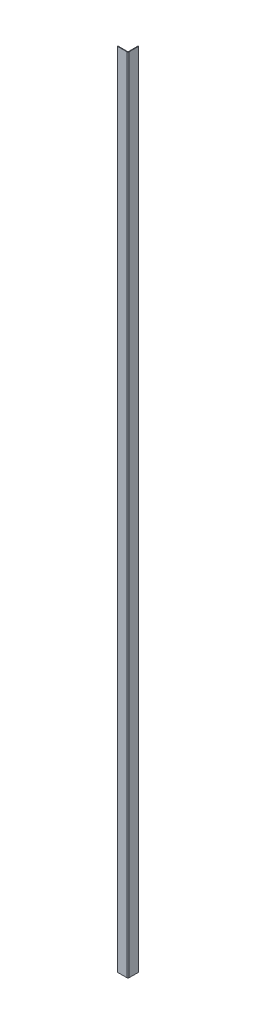
from build123d import *

# Parameters (mm, degrees)
SKETCH1_W                    = 40
SKETCH1_H                    = 3047
BASE_FLANGE1_DEPTH           = 2
EDGE_FLANGE1_STRIP_W         = 13
EDGE_FLANGE1_STRIP_H         = 2
EDGE_FLANGE1_STRIP_CUT_DEPTH = 3047
EDGE_FLANGE1_DEPTH           = 3047


# Sheet-metal steps are written as plain solids
with BuildPart() as part:
    # Sketch1 → Base-Flange1 (new body)
    with BuildSketch(Plane(origin=(0, 0, 0), x_dir=(0, 0, -1), z_dir=(1, 0, 0))):
        Rectangle(SKETCH1_W, SKETCH1_H)
    extrude(amount=-BASE_FLANGE1_DEPTH)

    # Edge-Flange1 strip (across the edge) → Edge-Flange1 strip cut (cut)
    with BuildSketch(Plane(origin=(-2, -1523.5, 20), x_dir=(0, 0, -1), z_dir=(0, 1, 0))):
        with Locations((-2, -1)):
            Rectangle(EDGE_FLANGE1_STRIP_W, EDGE_FLANGE1_STRIP_H)
    extrude(amount=EDGE_FLANGE1_STRIP_CUT_DEPTH, mode=Mode.SUBTRACT)

    # Edge-Flange1 section (across the edge) → Edge-Flange1 (add)
    with BuildSketch(Plane(origin=(-2, -1523.5, 20), x_dir=(0, 0, -1), z_dir=(0, 1, 0))):
        with BuildLine():
            Line((0, 2.5), (0, 38))
            Line((0, 38), (2, 38))
            Line((2, 38), (2, 2.5))
            ThreePointArc((2, 2.5), (2.732233047, 0.732233047), (4.5, 0))
            Line((4.5, 0), (4.5, -2))
            ThreePointArc((4.5, -2), (1.318019485, -0.681980515), (0, 2.5))
        make_face()
    extrude(amount=EDGE_FLANGE1_DEPTH)


solid = part.part
